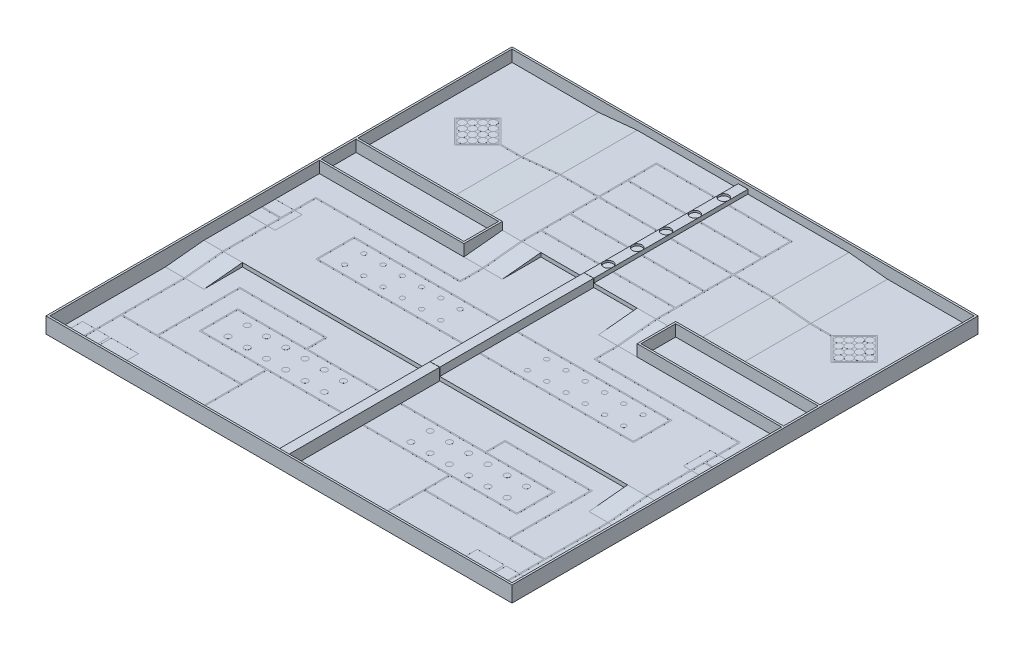
from build123d import *

# Parameters (mm, degrees)
SKETCH1_W            = 12100
SKETCH1_H            = 12100
BOSS_EXTRUDE1_DEPTH  = 10
SKETCH2_W            = 250
SKETCH2_H            = 12100
BOSS_EXTRUDE2_DEPTH  = 310
SKETCH3_W            = 12100
SKETCH3_H            = 12100
SKETCH3_W_2          = 12000
SKETCH3_H_2          = 12000
BOSS_EXTRUDE3_DEPTH  = 400
BOSS_EXTRUDE4_DEPTH  = 100
SKETCH5_W            = 12000
SKETCH5_H            = 4000
BOSS_EXTRUDE5_DEPTH  = 200
SKETCH8_W            = 3800
SKETCH8_H            = 1000
SKETCH8_W_2          = 3700
SKETCH8_H_2          = 900
BOSS_EXTRUDE9_DEPTH  = 300
SKETCH9_W            = 3250
SKETCH9_H            = 4000
CUT_EXTRUDE2_DEPTH   = 100
BOSS_EXTRUDE10_DEPTH = 4000
BOSS_EXTRUDE11_DEPTH = 1000
BOSS_EXTRUDE12_DEPTH = 1000
BOSS_EXTRUDE13_DEPTH = 1000
BOSS_EXTRUDE14_DEPTH = 1000
SKETCH15_W           = 250
SKETCH15_H           = 5
CUT_EXTRUDE3_DEPTH   = 300
SKETCH16_W           = 700
SKETCH16_H           = 700
CUT_EXTRUDE4_DEPTH   = 0.5
SKETCH18_W           = 700
SKETCH18_H           = 700
CUT_EXTRUDE5_DEPTH   = 0.5
SKETCH19_W           = 3250
SKETCH19_H           = 250
SKETCH19_R           = 45
BOSS_EXTRUDE15_DEPTH = 60
SKETCH20_R           = 75
BOSS_EXTRUDE16_DEPTH = 0.5
BOSS_EXTRUDE17_DEPTH = 1
BOSS_EXTRUDE18_DEPTH = 0.5
BOSS_EXTRUDE19_DEPTH = 30
BOSS_EXTRUDE20_DEPTH = 30
BOSS_EXTRUDE21_DEPTH = 0.5
SKETCH26_R           = 60
BOSS_EXTRUDE22_DEPTH = 0.5
BOSS_EXTRUDE23_DEPTH = 30
BOSS_EXTRUDE24_DEPTH = 30
BOSS_EXTRUDE25_DEPTH = 0.5
BOSS_EXTRUDE26_DEPTH = 30
BOSS_EXTRUDE27_DEPTH = 0.5
SKETCH32_R           = 94.5
BOSS_EXTRUDE30_DEPTH = 0.5
SKETCH33_R           = 124.5
CUT_EXTRUDE6_DEPTH   = 50


with BuildPart() as part:
    # Sketch1 → Boss-Extrude1 (new body)
    with BuildSketch(Plane(origin=(0, 0, 0), x_dir=(1, 0, 0), z_dir=(0, 1, 0))):
        Rectangle(SKETCH1_W, SKETCH1_H)
    extrude(amount=BOSS_EXTRUDE1_DEPTH)

    # Sketch2 → Boss-Extrude2 (add)
    with BuildSketch(Plane(origin=(0, 10, 0), x_dir=(1, 0, 0), z_dir=(0, 1, 0))):
        Rectangle(SKETCH2_W, SKETCH2_H)
    extrude(amount=BOSS_EXTRUDE2_DEPTH)

    # Sketch3 → Boss-Extrude3 (add)
    with BuildSketch(Plane(origin=(0, 10, 0), x_dir=(1, 0, 0), z_dir=(0, 1, 0))):
        Rectangle(SKETCH3_W, SKETCH3_H)
        Rectangle(SKETCH3_W_2, SKETCH3_H_2, mode=Mode.SUBTRACT)
    extrude(amount=BOSS_EXTRUDE3_DEPTH)

    # Sketch4 → Boss-Extrude4 (add)
    with BuildSketch(Plane(origin=(0, 10, 0), x_dir=(1, 0, 0), z_dir=(0, 1, 0))):
        Polygon((-6050, -2000), (6050, -2000), (6050, 2000), (-6050, 2000), (-6050, 0), align=None)
    extrude(amount=BOSS_EXTRUDE4_DEPTH)

    # Sketch5 → Boss-Extrude5 (add)
    with BuildSketch(Plane(origin=(0, 10, 0), x_dir=(1, 0, 0), z_dir=(0, 1, 0))):
        with Locations((0, 4000)):
            Rectangle(SKETCH5_W, SKETCH5_H)
    extrude(amount=BOSS_EXTRUDE5_DEPTH)

    # Sketch8 → Boss-Extrude9 (add)
    # profile 1 of 2: a face of its own
    with BuildSketch(Plane(origin=(0, 110, 0), x_dir=(1, 0, 0), z_dir=(0, 1, 0))):
        with Locations((4150, 1500)):
            Rectangle(SKETCH8_W, SKETCH8_H)
        with Locations((4150, 1500)):
            Rectangle(SKETCH8_W_2, SKETCH8_H_2, mode=Mode.SUBTRACT)
    # profile 2 of 2: a face of its own
    with BuildSketch(Plane(origin=(0, 110, 0), x_dir=(1, 0, 0), z_dir=(0, 1, 0))):
        with Locations((-4150, 1500)):
            Rectangle(SKETCH8_W, SKETCH8_H)
        with Locations((-4150, 1500)):
            Rectangle(SKETCH8_W_2, SKETCH8_H_2, mode=Mode.SUBTRACT)
    extrude(amount=BOSS_EXTRUDE9_DEPTH)

    # Sketch9 → Cut-Extrude2 (cut)
    with BuildSketch(Plane(origin=(0, 210, 0), x_dir=(1, 0, 0), z_dir=(0, 1, 0))):
        with Locations((4375, 4000)):
            Rectangle(SKETCH9_W, SKETCH9_H)
        with Locations((-4375, 4000)):
            Rectangle(SKETCH9_W, SKETCH9_H)
    extrude(amount=-CUT_EXTRUDE2_DEPTH, mode=Mode.SUBTRACT)

    # Sketch10 → Boss-Extrude10 (add)
    with BuildSketch(Plane.XY.offset(-6000)):
        Polygon((2750, 210), (2750, 110), (3750, 110), align=None)
        Polygon((-2750, 110), (-3750, 110), (-2750, 210), align=None)
    extrude(amount=BOSS_EXTRUDE10_DEPTH)

    # Sketch11 → Boss-Extrude11 (add)
    with BuildSketch(Plane.ZY.offset(-2250)):
        Polygon((-2000, 210), (-2000, 110), (-1000, 110), align=None)
    extrude(amount=BOSS_EXTRUDE11_DEPTH)

    # Sketch12 → Boss-Extrude12 (add)
    with BuildSketch(Plane(origin=(-2250, 0, 0), x_dir=(0, 0, -1), z_dir=(1, 0, 0))):
        Polygon((2000, 210), (2000, 110), (1000, 110), align=None)
    extrude(amount=BOSS_EXTRUDE12_DEPTH)

    # Sketch13 → Boss-Extrude13 (add)
    with BuildSketch(Plane.ZY.offset(-6000)):
        Polygon((2000, 110), (2000, 10), (3000, 10), align=None)
    extrude(amount=BOSS_EXTRUDE13_DEPTH)

    # Sketch14 → Boss-Extrude14 (add)
    with BuildSketch(Plane(origin=(-6000, 0, 0), x_dir=(0, 0, -1), z_dir=(1, 0, 0))):
        Polygon((-2000, 110), (-2000, 10), (-3000, 10), align=None)
    extrude(amount=BOSS_EXTRUDE14_DEPTH)

    # Sketch15 → Cut-Extrude3 (cut)
    with BuildSketch(Plane(origin=(0, 320, 0), x_dir=(1, 0, 0), z_dir=(0, 1, 0))):
        with Locations((0, 1997.5)):
            Rectangle(SKETCH15_W, SKETCH15_H)
        with Locations((0, -2002.5)):
            Rectangle(SKETCH15_W, SKETCH15_H)
    extrude(amount=-CUT_EXTRUDE3_DEPTH, mode=Mode.SUBTRACT)

    # Sketch16 → Cut-Extrude4 (cut)
    with BuildSketch(Plane(origin=(0, 10, 0), x_dir=(1, 0, 0), z_dir=(0, 1, 0))):
        with Locations((5500, -5650)):
            Rectangle(SKETCH16_W, SKETCH16_H)
        with Locations((4750, -5650)):
            Rectangle(SKETCH16_W, SKETCH16_H)
        with Locations((-4750, -5650)):
            Rectangle(SKETCH16_W, SKETCH16_H)
        with Locations((-5500, -5650)):
            Rectangle(SKETCH16_W, SKETCH16_H)
    extrude(amount=-CUT_EXTRUDE4_DEPTH, mode=Mode.SUBTRACT)

    # Sketch18 → Cut-Extrude5 (cut)
    with BuildSketch(Plane(origin=(0, 110, 0), x_dir=(1, 0, 0), z_dir=(0, 1, 0))):
        with Locations((5650, -500)):
            Rectangle(SKETCH18_W, SKETCH18_H)
        with Locations((-5650, -500)):
            Rectangle(SKETCH18_W, SKETCH18_H)
    extrude(amount=-CUT_EXTRUDE5_DEPTH, mode=Mode.SUBTRACT)

    # Sketch19 → Boss-Extrude15 (add)
    # profile 1 of 2: a face of its own
    with BuildSketch(Plane(origin=(0, 10, 0), x_dir=(1, 0, 0), z_dir=(0, 1, 0))):
        with Locations((2375, -5875)):
            Rectangle(SKETCH19_W, SKETCH19_H)
        with Locations((1000, -5875)):
            Circle(SKETCH19_R, mode=Mode.SUBTRACT)
        with Locations((1250, -5875)):
            Circle(SKETCH19_R, mode=Mode.SUBTRACT)
        with Locations((1500, -5875)):
            Circle(SKETCH19_R, mode=Mode.SUBTRACT)
        with Locations((1750, -5875)):
            Circle(SKETCH19_R, mode=Mode.SUBTRACT)
        with Locations((2000, -5875)):
            Circle(SKETCH19_R, mode=Mode.SUBTRACT)
        with Locations((2250, -5875)):
            Circle(SKETCH19_R, mode=Mode.SUBTRACT)
        with Locations((2500, -5875)):
            Circle(SKETCH19_R, mode=Mode.SUBTRACT)
        with Locations((2750, -5875)):
            Circle(SKETCH19_R, mode=Mode.SUBTRACT)
        with Locations((3000, -5875)):
            Circle(SKETCH19_R, mode=Mode.SUBTRACT)
        with Locations((3250, -5875)):
            Circle(SKETCH19_R, mode=Mode.SUBTRACT)
        with Locations((3500, -5875)):
            Circle(SKETCH19_R, mode=Mode.SUBTRACT)
        with Locations((3750, -5875)):
            Circle(SKETCH19_R, mode=Mode.SUBTRACT)
    # profile 2 of 2: a face of its own
    with BuildSketch(Plane(origin=(0, 10, 0), x_dir=(1, 0, 0), z_dir=(0, 1, 0))):
        with Locations((-2375, -5875)):
            Rectangle(SKETCH19_W, SKETCH19_H)
        with Locations((-3750, -5875)):
            Circle(SKETCH19_R, mode=Mode.SUBTRACT)
        with Locations((-3500, -5875)):
            Circle(SKETCH19_R, mode=Mode.SUBTRACT)
        with Locations((-3250, -5875)):
            Circle(SKETCH19_R, mode=Mode.SUBTRACT)
        with Locations((-3000, -5875)):
            Circle(SKETCH19_R, mode=Mode.SUBTRACT)
        with Locations((-2750, -5875)):
            Circle(SKETCH19_R, mode=Mode.SUBTRACT)
        with Locations((-2500, -5875)):
            Circle(SKETCH19_R, mode=Mode.SUBTRACT)
        with Locations((-2250, -5875)):
            Circle(SKETCH19_R, mode=Mode.SUBTRACT)
        with Locations((-2000, -5875)):
            Circle(SKETCH19_R, mode=Mode.SUBTRACT)
        with Locations((-1750, -5875)):
            Circle(SKETCH19_R, mode=Mode.SUBTRACT)
        with Locations((-1500, -5875)):
            Circle(SKETCH19_R, mode=Mode.SUBTRACT)
        with Locations((-1250, -5875)):
            Circle(SKETCH19_R, mode=Mode.SUBTRACT)
        with Locations((-1000, -5875)):
            Circle(SKETCH19_R, mode=Mode.SUBTRACT)
    extrude(amount=BOSS_EXTRUDE15_DEPTH)

    # Sketch20 → Boss-Extrude16 (add)
    with BuildSketch(Plane(origin=(0, 10, 0), x_dir=(1, 0, 0), z_dir=(0, 1, 0))):
        with Locations((1125, -3750)):
            Circle(SKETCH20_R)
        with Locations((1625, -3750)):
            Circle(SKETCH20_R)
        with Locations((2125, -3750)):
            Circle(SKETCH20_R)
        with Locations((2625, -3750)):
            Circle(SKETCH20_R)
        with Locations((3125, -3750)):
            Circle(SKETCH20_R)
        with Locations((3625, -3750)):
            Circle(SKETCH20_R)
        with Locations((1625, -3250)):
            Circle(SKETCH20_R)
        with Locations((2125, -3250)):
            Circle(SKETCH20_R)
        with Locations((2625, -3250)):
            Circle(SKETCH20_R)
        with Locations((3125, -3250)):
            Circle(SKETCH20_R)
        with Locations((3625, -3250)):
            Circle(SKETCH20_R)
        with Locations((1125, -3250)):
            Circle(SKETCH20_R)
        with Locations((-1125, -3250)):
            Circle(SKETCH20_R)
        with Locations((-3625, -3250)):
            Circle(SKETCH20_R)
        with Locations((-3125, -3250)):
            Circle(SKETCH20_R)
        with Locations((-2625, -3250)):
            Circle(SKETCH20_R)
        with Locations((-2125, -3250)):
            Circle(SKETCH20_R)
        with Locations((-1625, -3250)):
            Circle(SKETCH20_R)
        with Locations((-3625, -3750)):
            Circle(SKETCH20_R)
        with Locations((-3125, -3750)):
            Circle(SKETCH20_R)
        with Locations((-2625, -3750)):
            Circle(SKETCH20_R)
        with Locations((-2125, -3750)):
            Circle(SKETCH20_R)
        with Locations((-1625, -3750)):
            Circle(SKETCH20_R)
        with Locations((-1125, -3750)):
            Circle(SKETCH20_R)
    extrude(amount=BOSS_EXTRUDE16_DEPTH)

    # Sketch21 → Boss-Extrude17 (add)
    with BuildSketch(Plane(origin=(0, 9.5, 0), x_dir=(1, 0, 0), z_dir=(0, 1, 0))):
        Polygon((5485, -5300), (5485, -5635), (5150, -5635), (5150, -5665), (5485, -5665), (5485, -6000), (5515, -6000), (5515, -5665), (5850, -5665), (5850, -5635), (5515, -5635), (5515, -5300), (5515, -3000), (5485, -3000), align=None)
        Polygon((-5485, -3000), (-5515, -3000), (-5515, -5300), (-5515, -5635), (-5850, -5635), (-5850, -5665), (-5515, -5665), (-5515, -6000), (-5485, -6000), (-5485, -5665), (-5150, -5665), (-5150, -5635), (-5485, -5635), (-5485, -5300), align=None)
    extrude(amount=BOSS_EXTRUDE17_DEPTH)

    # Sketch22 → Boss-Extrude18 (add)
    # profile 1 of 2: a face of its own
    with BuildSketch(Plane(origin=(0, 10, 0), x_dir=(1, 0, 0), z_dir=(0, 1, 0))):
        Polygon((-125, -3970), (-125, -4000), (-2360, -4000), (-2360, -5750), (-2390, -5750), (-2390, -4665), (-5485, -4665), (-5485, -4635), (-4578, -4635), (-4578, -2490), (-2310, -2490), (-2310, -3000), (-125, -3000), (-125, -3030), (-4095, -3030), (-4095, -3970), align=None)
        Polygon((-4548, -4635), (-2390, -4635), (-2390, -4000), (-4125, -4000), (-4125, -3000), (-2340, -3000), (-2340, -2520), (-4548, -2520), align=None, mode=Mode.SUBTRACT)
    # profile 2 of 2: a face of its own
    with BuildSketch(Plane(origin=(0, 10, 0), x_dir=(1, 0, 0), z_dir=(0, 1, 0))):
        Polygon((5485, -4635), (4578, -4635), (4578, -2490), (2310, -2490), (2310, -3000), (125, -3000), (125, -3030), (4095, -3030), (4095, -3970), (125, -3970), (125, -4000), (2360, -4000), (2360, -5750), (2390, -5750), (2390, -4665), (5485, -4665), align=None)
        Polygon((4125, -3000), (4125, -4000), (2390, -4000), (2390, -4635), (4548, -4635), (4548, -2520), (2340, -2520), (2340, -3000), align=None, mode=Mode.SUBTRACT)
    extrude(amount=BOSS_EXTRUDE18_DEPTH)

    # Sketch23 → Boss-Extrude19 (add)
    with BuildSketch(Plane.ZY.offset(-5515)):
        Polygon((2000, 110), (2000, 110.5), (3000, 10.5), (3000, 10), align=None)
    extrude(amount=BOSS_EXTRUDE19_DEPTH)

    # Sketch24 → Boss-Extrude20 (add)
    with BuildSketch(Plane(origin=(-5515, 0, 0), x_dir=(0, 0, -1), z_dir=(1, 0, 0))):
        Polygon((-3000, 10), (-3000, 10.5), (-2000, 110.5), (-2000, 110), align=None)
    extrude(amount=BOSS_EXTRUDE20_DEPTH)

    # Sketch25 → Boss-Extrude21 (add)
    with BuildSketch(Plane(origin=(0, 110, 0), x_dir=(1, 0, 0), z_dir=(0, 1, 0))):
        Polygon((5515, -2000), (5515, -515), (6000, -515), (6000, -485), (5515, -485), (5515, 420), (1765, 420), (1765, 1000), (1735, 1000), (1735, 390), (5485, 390), (5485, -2000), align=None)
        Polygon((-5485, -2000), (-5515, -2000), (-5515, -515), (-6000, -515), (-6000, -485), (-5515, -485), (-5515, 420), (-1765, 420), (-1765, 1000), (-1735, 1000), (-1735, 390), (-5485, 390), align=None)
    extrude(amount=BOSS_EXTRUDE21_DEPTH)

    # Sketch26 → Boss-Extrude22 (add)
    with BuildSketch(Plane(origin=(0, 110, 0), x_dir=(1, 0, 0), z_dir=(0, 1, 0))):
        with Locations((3625, -222.5)):
            Circle(SKETCH26_R)
        with Locations((3125, -222.5)):
            Circle(SKETCH26_R)
        with Locations((2625, -222.5)):
            Circle(SKETCH26_R)
        with Locations((2125, -222.5)):
            Circle(SKETCH26_R)
        with Locations((1625, -222.5)):
            Circle(SKETCH26_R)
        with Locations((1125, -222.5)):
            Circle(SKETCH26_R)
        with Locations((3125, -722.5)):
            Circle(SKETCH26_R)
        with Locations((2625, -722.5)):
            Circle(SKETCH26_R)
        with Locations((2125, -722.5)):
            Circle(SKETCH26_R)
        with Locations((1625, -722.5)):
            Circle(SKETCH26_R)
        with Locations((1125, -722.5)):
            Circle(SKETCH26_R)
        with Locations((3625, -722.5)):
            Circle(SKETCH26_R)
        with Locations((-3625, -722.5)):
            Circle(SKETCH26_R)
        with Locations((-1125, -722.5)):
            Circle(SKETCH26_R)
        with Locations((-1625, -722.5)):
            Circle(SKETCH26_R)
        with Locations((-2125, -722.5)):
            Circle(SKETCH26_R)
        with Locations((-2625, -722.5)):
            Circle(SKETCH26_R)
        with Locations((-3125, -722.5)):
            Circle(SKETCH26_R)
        with Locations((-1125, -222.5)):
            Circle(SKETCH26_R)
        with Locations((-1625, -222.5)):
            Circle(SKETCH26_R)
        with Locations((-2125, -222.5)):
            Circle(SKETCH26_R)
        with Locations((-2625, -222.5)):
            Circle(SKETCH26_R)
        with Locations((-3125, -222.5)):
            Circle(SKETCH26_R)
        with Locations((-3625, -222.5)):
            Circle(SKETCH26_R)
        Polygon((125, 27.5), (4125, 27.5), (4125, -972.5), (125, -972.5), (125, -942.5), (4095, -942.5), (4095, -2.5), (125, -2.5), align=None)
        Polygon((-125, -2.5), (-125, 27.5), (-4125, 27.5), (-4125, -972.5), (-125, -972.5), (-125, -942.5), (-4095, -942.5), (-4095, -2.5), align=None)
    extrude(amount=BOSS_EXTRUDE22_DEPTH)

    # Sketch27 → Boss-Extrude23 (add)
    with BuildSketch(Plane.ZY.offset(-1765)):
        Polygon((-2000, 210), (-1000, 110), (-1000, 110.5), (-2000, 210.5), align=None)
    extrude(amount=BOSS_EXTRUDE23_DEPTH)

    # Sketch28 → Boss-Extrude24 (add)
    with BuildSketch(Plane(origin=(-1765, 0, 0), x_dir=(0, 0, -1), z_dir=(1, 0, 0))):
        Polygon((1000, 110), (2000, 210), (2000, 210.5), (1000, 110.5), align=None)
    extrude(amount=BOSS_EXTRUDE24_DEPTH)

    # Sketch29 → Boss-Extrude25 (add)
    with BuildSketch(Plane(origin=(0, 210, 0), x_dir=(1, 0, 0), z_dir=(0, 1, 0))):
        Polygon((1765, 2000), (1765, 3985), (2750, 3985), (2750, 4015), (1765, 4015), (1765, 5515), (125, 5515), (125, 5485), (1735, 5485), (1735, 4765), (125, 4765), (125, 4735), (1735, 4735), (1735, 4015), (125, 4015), (125, 3985), (1735, 3985), (1735, 3265), (125, 3265), (125, 3235), (1735, 3235), (1735, 2515), (125, 2515), (125, 2485), (1735, 2485), (1735, 2000), align=None)
        Polygon((-1735, 2000), (-1765, 2000), (-1765, 3985), (-2750, 3985), (-2750, 4015), (-1765, 4015), (-1765, 5515), (-125, 5515), (-125, 5485), (-1735, 5485), (-1735, 4765), (-125, 4765), (-125, 4735), (-1735, 4735), (-1735, 4015), (-125, 4015), (-125, 3985), (-1735, 3985), (-1735, 3265), (-125, 3265), (-125, 3235), (-1735, 3235), (-1735, 2515), (-125, 2515), (-125, 2485), (-1735, 2485), align=None)
    extrude(amount=BOSS_EXTRUDE25_DEPTH)

    # Sketch30 → Boss-Extrude26 (add)
    with BuildSketch(Plane.XY.offset(-4015)):
        Polygon((2750, 210), (3750, 110), (3750, 110.5), (2750, 210.5), align=None)
        Polygon((-2750, 210), (-3750, 110), (-3750, 110.5), (-2750, 210.5), align=None)
    extrude(amount=BOSS_EXTRUDE26_DEPTH)

    # Sketch31 → Boss-Extrude27 (add)
    # profile 1 of 2: a face of its own
    with BuildSketch(Plane(origin=(0, 110, 0), x_dir=(1, 0, 0), z_dir=(0, 1, 0))):
        Polygon((4890.040764009, 4601.040764009), (4304, 4015), (3750, 4015), (3750, 3985), (4304, 3985), (4890.040764009, 3398.959235991), (5491.081528017, 4000), align=None)
        Polygon((5448.655121146, 4000), (4890.040764009, 4558.614357137), (4331.426406871, 4000), (4890.040764009, 3441.385642863), align=None, mode=Mode.SUBTRACT)
    # profile 2 of 2: a face of its own
    with BuildSketch(Plane(origin=(0, 110, 0), x_dir=(1, 0, 0), z_dir=(0, 1, 0))):
        Polygon((-3750, 3985), (-4304, 3985), (-4890.040764009, 3398.959235991), (-5491.081528017, 4000), (-4890.040764009, 4601.040764009), (-4304, 4015), (-3750, 4015), align=None)
        Polygon((-4890.040764009, 3441.385642863), (-5448.655121146, 4000), (-4890.040764009, 4558.614357137), (-4331.426406871, 4000), align=None, mode=Mode.SUBTRACT)
    extrude(amount=BOSS_EXTRUDE27_DEPTH)

    # Sketch32 → Boss-Extrude30 (add)
    with BuildSketch(Plane(origin=(0, 110, 0), x_dir=(1, 0, 0), z_dir=(0, 1, 0))):
        with Locations((4890.040764009, 4134.350288425)):
            Circle(SKETCH32_R)
        with Locations((4755.690475583, 4268.700576851)):
            Circle(SKETCH32_R)
        with Locations((5024.391052434, 4000)):
            Circle(SKETCH32_R)
        with Locations((5158.741340859, 3865.649711575)):
            Circle(SKETCH32_R)
        with Locations((5024.391052434, 3731.299423149)):
            Circle(SKETCH32_R)
        with Locations((4890.040764009, 3865.649711575)):
            Circle(SKETCH32_R)
        with Locations((4755.690475583, 4000)):
            Circle(SKETCH32_R)
        with Locations((4621.340187158, 4134.350288425)):
            Circle(SKETCH32_R)
        with Locations((4890.040764009, 3596.949134724)):
            Circle(SKETCH32_R)
        with Locations((4755.690475583, 3731.299423149)):
            Circle(SKETCH32_R)
        with Locations((4621.340187158, 3865.649711575)):
            Circle(SKETCH32_R)
        with Locations((4486.989898732, 4000)):
            Circle(SKETCH32_R)
        with Locations((5293.091629285, 4000)):
            Circle(SKETCH32_R)
        with Locations((5158.741340859, 4134.350288425)):
            Circle(SKETCH32_R)
        with Locations((5024.391052434, 4268.700576851)):
            Circle(SKETCH32_R)
        with Locations((4890.040764009, 4403.050865276)):
            Circle(SKETCH32_R)
        with Locations((-4890.040764009, 4403.050865276)):
            Circle(SKETCH32_R)
        with Locations((-5024.391052434, 4268.700576851)):
            Circle(SKETCH32_R)
        with Locations((-5158.741340859, 4134.350288425)):
            Circle(SKETCH32_R)
        with Locations((-5293.091629285, 4000)):
            Circle(SKETCH32_R)
        with Locations((-4486.989898732, 4000)):
            Circle(SKETCH32_R)
        with Locations((-4621.340187158, 3865.649711575)):
            Circle(SKETCH32_R)
        with Locations((-4755.690475583, 3731.299423149)):
            Circle(SKETCH32_R)
        with Locations((-4890.040764009, 3596.949134724)):
            Circle(SKETCH32_R)
        with Locations((-4621.340187158, 4134.350288425)):
            Circle(SKETCH32_R)
        with Locations((-4755.690475583, 4000)):
            Circle(SKETCH32_R)
        with Locations((-4890.040764009, 3865.649711575)):
            Circle(SKETCH32_R)
        with Locations((-5024.391052434, 3731.299423149)):
            Circle(SKETCH32_R)
        with Locations((-5158.741340859, 3865.649711575)):
            Circle(SKETCH32_R)
        with Locations((-5024.391052434, 4000)):
            Circle(SKETCH32_R)
        with Locations((-4755.690475583, 4268.700576851)):
            Circle(SKETCH32_R)
        with Locations((-4890.040764009, 4134.350288425)):
            Circle(SKETCH32_R)
    extrude(amount=BOSS_EXTRUDE30_DEPTH)

    # Sketch33 → Cut-Extrude6 (cut)
    with BuildSketch(Plane(origin=(0, 320, 0), x_dir=(1, 0, 0), z_dir=(0, 1, 0))):
        with Locations((0, 5500)):
            Circle(SKETCH33_R)
        with Locations((0, 4750)):
            Circle(SKETCH33_R)
        with Locations((0, 4000)):
            Circle(SKETCH33_R)
        with Locations((0, 3250)):
            Circle(SKETCH33_R)
        with Locations((0, 2500)):
            Circle(SKETCH33_R)
    extrude(amount=-CUT_EXTRUDE6_DEPTH, mode=Mode.SUBTRACT)


solid = part.part
